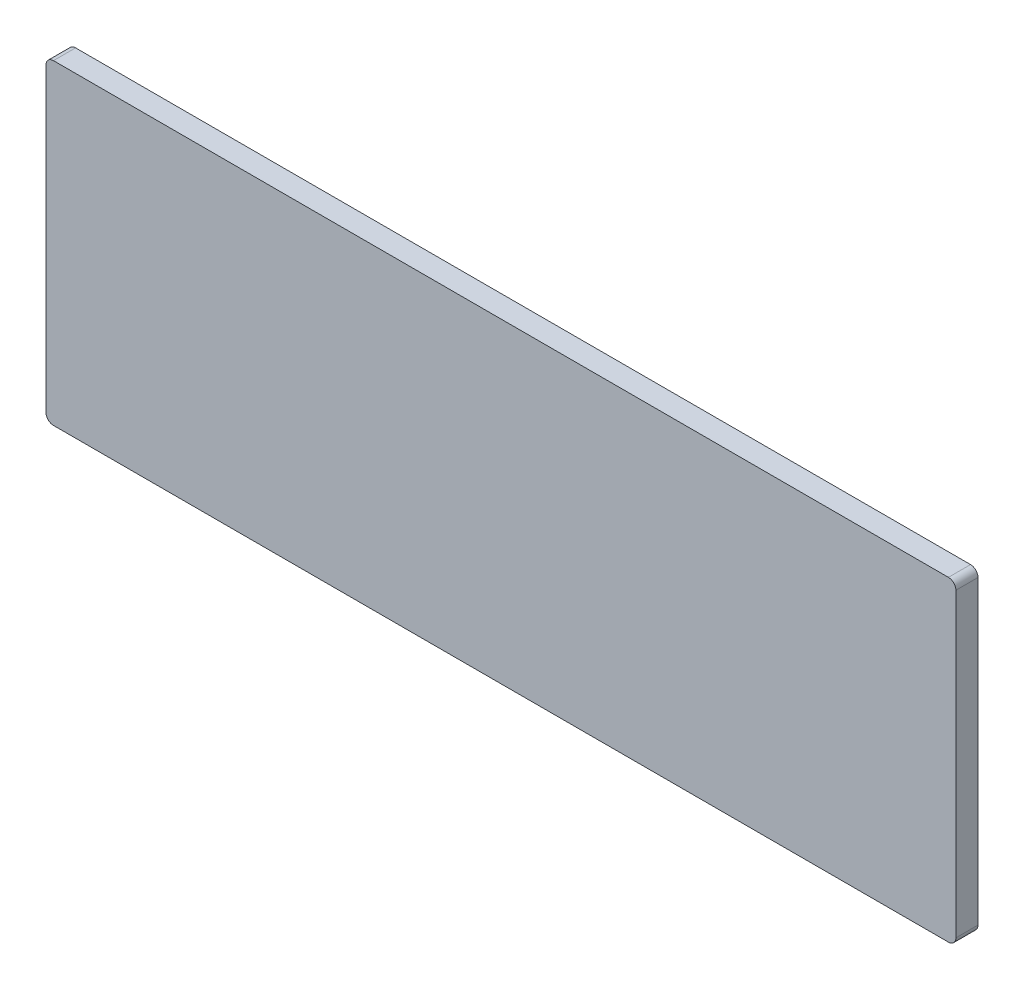
from build123d import *

# Parameters (mm, degrees)
SKETCH1_W           = 1828.8
SKETCH1_H           = 635
BOSS_EXTRUDE1_DEPTH = 44.45
FILLET1_R           = 15


with BuildPart() as part:
    # Sketch1 → Boss-Extrude1 (new body)
    with BuildSketch(Plane.XY):
        Rectangle(SKETCH1_W, SKETCH1_H)
    extrude(amount=-BOSS_EXTRUDE1_DEPTH)

    # Fillet1
    fillet1_edges = [part.edges().sort_by_distance(p)[0] for p in [
        (914.4, -317.5, -22.225),
        (914.4, 317.5, -22.225),
        (-914.4, 317.5, -22.225),
        (-914.4, -317.5, -22.225),
    ]]
    fillet(fillet1_edges, radius=FILLET1_R)


solid = part.part
